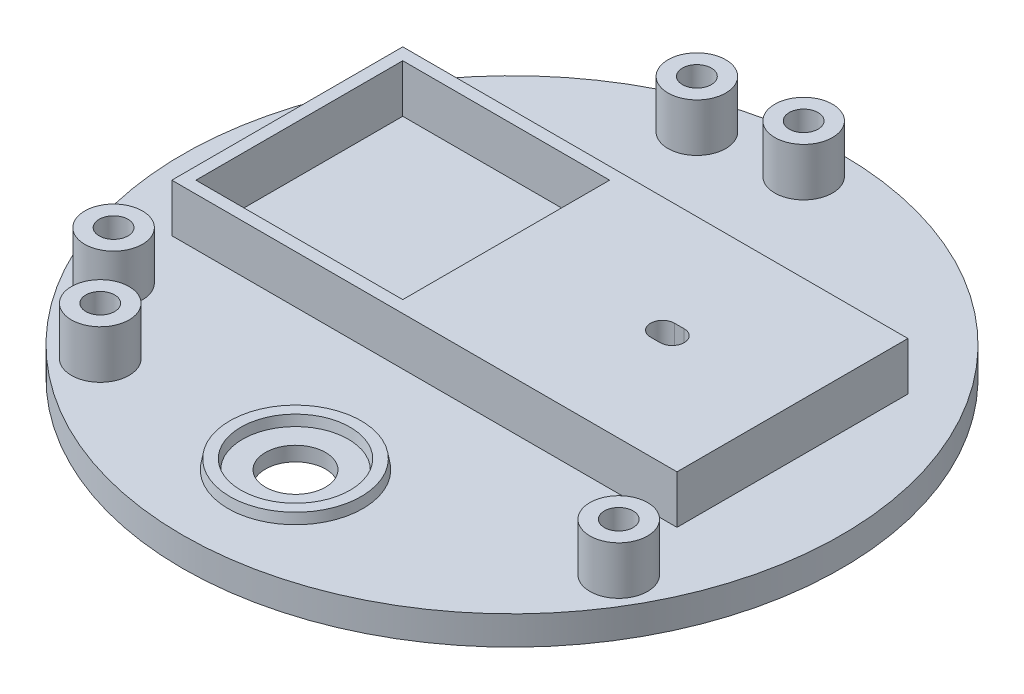
from build123d import *

# Parameters (mm, degrees)
SKETCH2_R           = 6
SKETCH2_R_2         = 3
BOSS_EXTRUDE1_DEPTH = 10
SKETCH3_R           = 6.25
CUT_EXTRUDE1_DEPTH  = 10
SKETCH4_R           = 14
SKETCH4_R_2         = 11
BOSS_EXTRUDE2_DEPTH = 2
BOSS_EXTRUDE2_DRAFT = 10
SKETCH5_W           = 105
SKETCH5_H           = 48
SKETCH5_W_2         = 43
SKETCH5_H_2         = 43
BOSS_EXTRUDE3_DEPTH = 10


with BuildPart() as part:
    # Sketch1 → Revolve1 (revolve)
    with BuildSketch(Plane.XY):
        with BuildLine():
            Line((0, 0), (68.5, 0))
            Line((68.5, 0), (68.5, -6))
            Line((68.5, -6), (66.5, -6))
            Line((66.5, -6), (66.5, -3))
            Line((66.5, -3), (62.351595203, -3))
            ThreePointArc((62.351595203, -3), (60, -2.3), (57.648404797, -3))
            Line((57.648404797, -3), (53.5, -3))
            Line((53.5, -3), (53.5, -6))
            Line((53.5, -6), (50.5, -6))
            Line((50.5, -6), (50.5, -3))
            Line((50.5, -3), (6, -3))
            Line((6, -3), (6, -5))
            Line((6, -5), (0, -5))
            Line((0, -5), (0, 0))
        make_face()
    revolve(axis=Axis((0, -5, 0), (0, 1, 0)))

    # Sketch2 → Boss-Extrude1 (add)
    # profile 1 of 5: a face of its own
    with BuildSketch(Plane(origin=(0, 0, 0), x_dir=(1, 0, 0), z_dir=(0, 1, 0))):
        with Locations((0, 60.621778265)):
            Circle(SKETCH2_R)
        with Locations((0, 60.621778265)):
            Circle(SKETCH2_R_2, mode=Mode.SUBTRACT)
    # profile 2 of 5: a face of its own
    with BuildSketch(Plane(origin=(0, 0, 0), x_dir=(1, 0, 0), z_dir=(0, 1, 0))):
        with Locations((52.5, -30.310889132)):
            Circle(SKETCH2_R)
        with Locations((52.5, -30.310889132)):
            Circle(SKETCH2_R_2, mode=Mode.SUBTRACT)
    # profile 3 of 5: a face of its own
    with BuildSketch(Plane(origin=(0, 0, 0), x_dir=(1, 0, 0), z_dir=(0, 1, 0))):
        with Locations((-52.5, -30.310889132)):
            Circle(SKETCH2_R)
        with Locations((-52.5, -30.310889132)):
            Circle(SKETCH2_R_2, mode=Mode.SUBTRACT)
    # profile 4 of 5: a face of its own
    with BuildSketch(Plane(origin=(0, 0, 0), x_dir=(1, 0, 0), z_dir=(0, 1, 0))):
        with Locations((-40.273109217, -45.310889132)):
            Circle(SKETCH2_R)
        with Locations((-40.273109217, -45.310889132)):
            Circle(SKETCH2_R_2, mode=Mode.SUBTRACT)
    # profile 5 of 5: a face of its own
    with BuildSketch(Plane(origin=(0, 0, 0), x_dir=(1, 0, 0), z_dir=(0, 1, 0))):
        with Locations((-19.103826448, 57.532980238)):
            Circle(SKETCH2_R)
        with Locations((-19.103826448, 57.532980238)):
            Circle(SKETCH2_R_2, mode=Mode.SUBTRACT)
    extrude(amount=BOSS_EXTRUDE1_DEPTH)

    # Sketch3 → Cut-Extrude1 (cut)
    with BuildSketch(Plane(origin=(0, 0, 0), x_dir=(1, 0, 0), z_dir=(0, 1, 0))):
        with Locations((0, -45)):
            Circle(SKETCH3_R)
    extrude(amount=-CUT_EXTRUDE1_DEPTH, mode=Mode.SUBTRACT)


with BuildPart() as boss_extrude2_tool:
    # Sketch4 → Boss-Extrude2 (with draft: the straight prism first)
    with BuildSketch(Plane(origin=(0, 0, 0), x_dir=(1, 0, 0), z_dir=(0, 1, 0))):
        with Locations((0, -45)):
            Circle(SKETCH4_R)
        with Locations((0, -45)):
            Circle(SKETCH4_R_2, mode=Mode.SUBTRACT)
    extrude(amount=BOSS_EXTRUDE2_DEPTH)
    # Boss-Extrude2: the draft: its side faces are tilted about the plane it starts from
    boss_extrude2_sides = [boss_extrude2_tool.faces().sort_by_distance(p)[0] for p in [
        (-14, 1, 45),
        (-11, 1, 45),
    ]]
    draft(boss_extrude2_sides, Plane(origin=(0, 0, 0), x_dir=(1, 0, 0), z_dir=(0, 1, 0)), BOSS_EXTRUDE2_DRAFT)


with BuildPart() as part_1:
    add(part.part)

    # Boss-Extrude2: add boss_extrude2_tool
    add(boss_extrude2_tool.part)

    # Sketch5 → Boss-Extrude3 (add)
    with BuildSketch(Plane(origin=(0, 0, 0), x_dir=(1, 0, 0), z_dir=(0, 1, 0))):
        with Locations((-2.486934699, 8.278447611)):
            Rectangle(SKETCH5_W, SKETCH5_H)
        with BuildLine():
            Line((25.013065301, 5.778447611), (23.013065301, 5.778447611))
            ThreePointArc((23.013065301, 5.778447611), (20.513065301, 8.278447611), (23.013065301, 10.778447611))
            Line((23.013065301, 10.778447611), (25.013065301, 10.778447611))
            ThreePointArc((25.013065301, 10.778447611), (27.513065301, 8.278447611), (25.013065301, 5.778447611))
        make_face(mode=Mode.SUBTRACT)
        with Locations((-30.986934699, 8.278447611)):
            Rectangle(SKETCH5_W_2, SKETCH5_H_2, mode=Mode.SUBTRACT)
    extrude(amount=BOSS_EXTRUDE3_DEPTH)


solid = part_1.part
